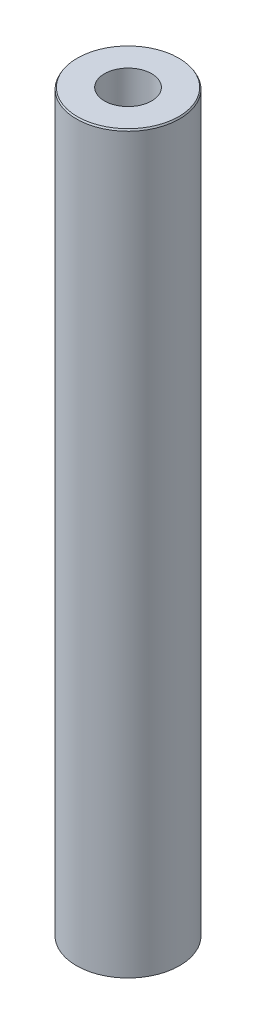
from build123d import *
from OCP.BRepFilletAPI import BRepFilletAPI_MakeChamfer

# Parameters (mm, degrees)
SKETCH1_R           = 27.5
BOSS_EXTRUDE1_DEPTH = 391.997729105
SKETCH2_R           = 12.585780611
CUT_EXTRUDE1_DEPTH  = 394.922225349
CHAMFER1_SIZE       = 0.840691977
CHAMFER1_SIZE2      = 0.485373739


with BuildPart() as part:
    # Sketch1 → Boss-Extrude1 (new body)
    with BuildSketch(Plane(origin=(0, 0, 0), x_dir=(1, 0, 0), z_dir=(0, 1, 0))):
        Circle(SKETCH1_R)
    extrude(amount=BOSS_EXTRUDE1_DEPTH)

    # Sketch2 → Cut-Extrude1 (cut, through all)
    with BuildSketch(Plane(origin=(0, 0, 0), x_dir=(1, 0, 0), z_dir=(0, 1, 0))):
        Circle(SKETCH2_R)
    extrude(amount=CUT_EXTRUDE1_DEPTH, mode=Mode.SUBTRACT)

    # Chamfer1: one chamfer whose edges measure the first distance from different faces: ONE call of the kernel's chamfer builder (chamfer() names one face for all edges)
    chamfer1_edges_1 = [part.edges().sort_by_distance(p)[0] for p in [
        (-27.5, 391.997729105, 0),
    ]]
    chamfer1_side_1 = [part.faces().sort_by_distance(p)[0] for p in [
        (-27.5, 195.998864553, 0),
    ]]
    chamfer1_edges_2 = [part.edges().sort_by_distance(p)[0] for p in [
        (-27.5, 0, 0),
    ]]
    chamfer1_side_2 = [part.faces().sort_by_distance(p)[0] for p in [
        (-26.722182541, 0, 0),
    ]]
    chamfer1 = BRepFilletAPI_MakeChamfer(part.part.solid().wrapped)
    for e in chamfer1_edges_1:
        chamfer1.Add(CHAMFER1_SIZE, CHAMFER1_SIZE2, e.wrapped, chamfer1_side_1[0].wrapped)  # the first distance lies on this face
    for e in chamfer1_edges_2:
        chamfer1.Add(CHAMFER1_SIZE, CHAMFER1_SIZE2, e.wrapped, chamfer1_side_2[0].wrapped)  # the first distance lies on this face
    add(Compound.cast(chamfer1.Shape()), mode=Mode.REPLACE)


solid = part.part
